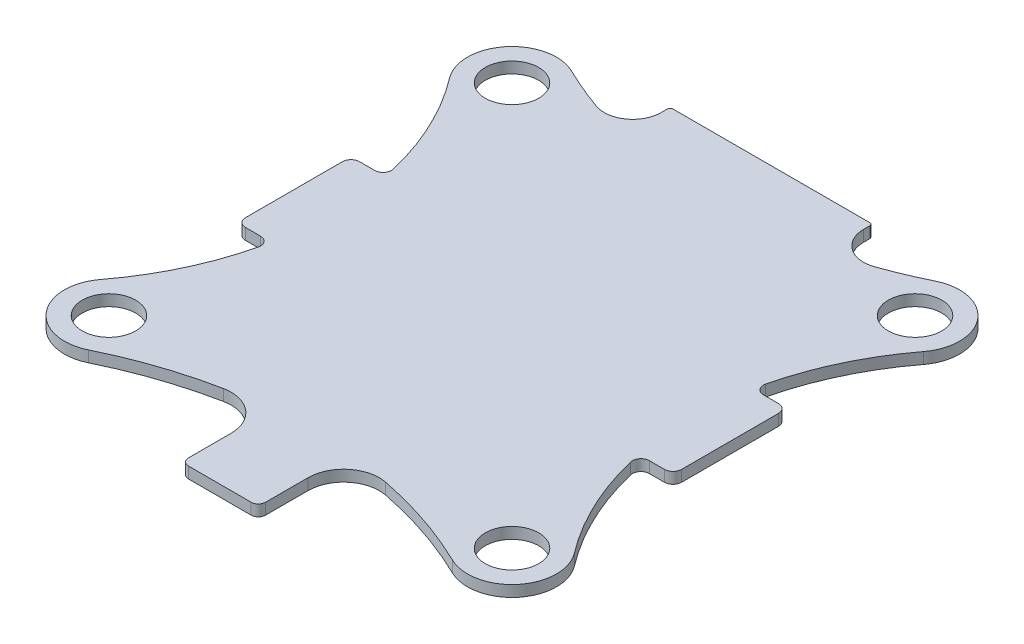
from build123d import *

# Parameters (mm, degrees)
SKETCH1_R           = 2.38125
BOSS_EXTRUDE2_DEPTH = 1


with BuildPart() as part:
    # Sketch1 → Boss-Extrude2 (new body)
    with BuildSketch(Plane(origin=(0, 0, 0), x_dir=(1, 0, 0), z_dir=(0, 1, 0))):
        with BuildLine():
            Line((-18.669, -5.08), (-17.330956316, -5.08))
            ThreePointArc((-17.330956316, -5.08), (-16.732344988, -5.370503999), (-16.590161442, -6.020513179))
            ThreePointArc((-16.590161442, -6.020513179), (-18.359695736, -11.0243031), (-21.119367367, -15.557886415))
            ThreePointArc((-21.119367367, -15.557886415), (-21.028176895, -20.478529347), (-16.219689319, -21.527094936))
            ThreePointArc((-16.219689319, -21.527094936), (-11.819779224, -19.719953138), (-7.224293819, -18.492563955))
            ThreePointArc((-7.224293819, -18.492563955), (-4.590148947, -19.151788204), (-3.429, -21.60638164))
            Line((-3.429, -21.60638164), (-3.429, -25.4))
            ThreePointArc((-3.429, -25.4), (-3.243012806, -25.849012806), (-2.794, -26.035))
            Line((-2.794, -26.035), (2.794, -26.035))
            ThreePointArc((2.794, -26.035), (3.243012806, -25.849012806), (3.429, -25.4))
            Line((3.429, -25.4), (3.429, -21.60638164))
            ThreePointArc((3.429, -21.60638164), (4.590148947, -19.151788204), (7.224293819, -18.492563955))
            ThreePointArc((7.224293819, -18.492563955), (11.819779224, -19.719953138), (16.219689319, -21.527094936))
            ThreePointArc((16.219689319, -21.527094936), (21.028176895, -20.478529347), (21.119367367, -15.557886415))
            ThreePointArc((21.119367367, -15.557886415), (18.359695736, -11.0243031), (16.590161442, -6.020513179))
            ThreePointArc((16.590161442, -6.020513179), (16.732344988, -5.370503999), (17.330956316, -5.08))
            Line((17.330956316, -5.08), (18.669, -5.08))
            ThreePointArc((18.669, -5.08), (19.207815367, -4.856815367), (19.431, -4.318))
            Line((19.431, -4.318), (19.431, 4.318))
            ThreePointArc((19.431, 4.318), (19.207815367, 4.856815367), (18.669, 5.08))
            Line((18.669, 5.08), (17.330956316, 5.08))
            ThreePointArc((17.330956316, 5.08), (16.732344988, 5.370503999), (16.590161442, 6.020513179))
            ThreePointArc((16.590161442, 6.020513179), (18.359695736, 11.0243031), (21.119367367, 15.557886415))
            ThreePointArc((21.119367367, 15.557886415), (21.028176895, 20.478529347), (16.219689319, 21.527094936))
            ThreePointArc((16.219689319, 21.527094936), (14.33695631, 20.672470664), (12.409398698, 19.924414596))
            ThreePointArc((12.409398698, 19.924414596), (10.093014463, 20.241459615), (9.017, 22.317115258))
            Line((9.017, 22.317115258), (9.017, 22.86))
            ThreePointArc((9.017, 22.86), (8.942605122, 23.039605122), (8.763, 23.114))
            Line((8.763, 23.114), (-8.763, 23.114))
            ThreePointArc((-8.763, 23.114), (-8.942605122, 23.039605122), (-9.017, 22.86))
            Line((-9.017, 22.86), (-9.017, 22.317115258))
            ThreePointArc((-9.017, 22.317115258), (-10.093014463, 20.241459615), (-12.409398698, 19.924414596))
            ThreePointArc((-12.409398698, 19.924414596), (-14.33695631, 20.672470664), (-16.219689319, 21.527094936))
            ThreePointArc((-16.219689319, 21.527094936), (-21.028176895, 20.478529347), (-21.119367367, 15.557886415))
            ThreePointArc((-21.119367367, 15.557886415), (-18.359695736, 11.0243031), (-16.590161442, 6.020513179))
            ThreePointArc((-16.590161442, 6.020513179), (-16.732344988, 5.370503999), (-17.330956316, 5.08))
            Line((-17.330956316, 5.08), (-18.669, 5.08))
            ThreePointArc((-18.669, 5.08), (-19.207815367, 4.856815367), (-19.431, 4.318))
            Line((-19.431, 4.318), (-19.431, -4.318))
            ThreePointArc((-19.431, -4.318), (-19.207815367, -4.856815367), (-18.669, -5.08))
        make_face()
        with Locations((-17.960512242, -17.960512242)):
            Circle(SKETCH1_R, mode=Mode.SUBTRACT)
        with Locations((17.960512242, -17.960512242)):
            Circle(SKETCH1_R, mode=Mode.SUBTRACT)
        with Locations((-17.960512242, 17.960512242)):
            Circle(SKETCH1_R, mode=Mode.SUBTRACT)
        with Locations((17.960512242, 17.960512242)):
            Circle(SKETCH1_R, mode=Mode.SUBTRACT)
    extrude(amount=BOSS_EXTRUDE2_DEPTH)


solid = part.part
